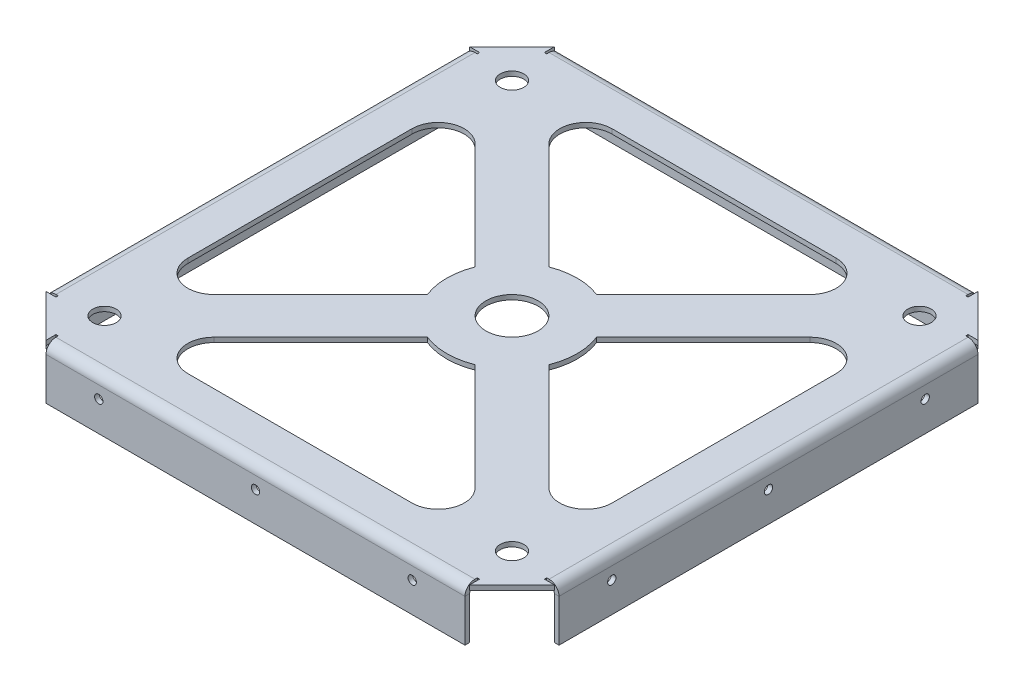
from build123d import *

# Parameters (mm, degrees)
BASE_FLANGE1_START              = -0.9
BASE_FLANGE1_DEPTH              = 0.9
EDGE_FLANGE1_STRIP_W            = 5.6
EDGE_FLANGE1_STRIP_H            = 0.9
EDGE_FLANGE1_STRIP_CUT_DEPTH    = 80.2
EDGE_FLANGE1_RELIEF_W           = 6.05
EDGE_FLANGE1_RELIEF_H           = 0.45
EDGE_FLANGE1_RELIEF_CUT_DEPTH   = 0.9
EDGE_FLANGE1_STRIP_2_W          = 5.6
EDGE_FLANGE1_STRIP_2_H          = 0.9
EDGE_FLANGE1_STRIP_CUT_2_DEPTH  = 80.2
EDGE_FLANGE1_RELIEF_2_W         = 6.05
EDGE_FLANGE1_RELIEF_2_H         = 0.45
EDGE_FLANGE1_RELIEF_CUT_2_DEPTH = 0.9
EDGE_FLANGE1_STRIP_3_W          = 5.6
EDGE_FLANGE1_STRIP_3_H          = 0.9
EDGE_FLANGE1_STRIP_CUT_3_DEPTH  = 80.2
EDGE_FLANGE1_RELIEF_3_W         = 6.05
EDGE_FLANGE1_RELIEF_3_H         = 0.45
EDGE_FLANGE1_RELIEF_CUT_3_DEPTH = 0.9
EDGE_FLANGE1_STRIP_4_W          = 5.6
EDGE_FLANGE1_STRIP_4_H          = 0.9
EDGE_FLANGE1_STRIP_CUT_4_DEPTH  = 80.2
EDGE_FLANGE1_RELIEF_4_W         = 6.05
EDGE_FLANGE1_RELIEF_4_H         = 0.45
EDGE_FLANGE1_RELIEF_CUT_4_DEPTH = 0.9
EDGE_FLANGE1_DEPTH              = 80.2
EDGE_FLANGE1_BEND_DEPTH         = 80.2
EDGE_FLANGE1_BEND_2_DEPTH       = 80.2
EDGE_FLANGE1_BEND_3_DEPTH       = 80.2
SKETCH18_R                      = 5
CUT_EXTRUDE1_DEPTH              = 10
M2X0_4_TAPPED_HOLE1_D           = 1.6
M2X0_4_TAPPED_HOLE1_DEPTH       = 5.2
M2X0_4_TAPPED_HOLE1_TIP         = 0.480688495
M2X0_4_TAPPED_HOLE2_D           = 1.6
M2X0_4_TAPPED_HOLE2_DEPTH       = 5.2
M2X0_4_TAPPED_HOLE2_TIP         = 0.480688495
M2X0_4_TAPPED_HOLE3_D           = 1.6
M2X0_4_TAPPED_HOLE3_DEPTH       = 5.2
M2X0_4_TAPPED_HOLE3_TIP         = 0.480688495
M2X0_4_TAPPED_HOLE4_D           = 1.6
M2X0_4_TAPPED_HOLE4_DEPTH       = 5.2
M2X0_4_TAPPED_HOLE4_TIP         = 0.480688495
M4_CLEARANCE_HOLE1_D            = 4.5


# Read off the part's stored shape, not the designer's step: Base-Flange1
# Sheet-metal steps are written as plain solids
with BuildPart() as part:
    # Base-Flange1 outline → Base-Flange1 (new body)
    with BuildSketch(Plane(origin=(0, 0, 0), x_dir=(1, 0, 0), z_dir=(0, 1, 0)).offset(BASE_FLANGE1_START)):
        Polygon((98.2, 89.2), (89.2, 98.2), (9, 98.2), (0, 89.2), (0, 9), (9, 0), (89.2, 0), (98.2, 9), align=None)
    extrude(amount=BASE_FLANGE1_DEPTH)

    # Edge-Flange1 strip (across the edge) → Edge-Flange1 strip cut (cut)
    with BuildSketch(Plane(origin=(98.2, -0.9, -89.2), x_dir=(-1, 0, 0), z_dir=(0, 0, 1))):
        with Locations((-0.9, -0.45)):
            Rectangle(EDGE_FLANGE1_STRIP_W, EDGE_FLANGE1_STRIP_H)
    extrude(amount=EDGE_FLANGE1_STRIP_CUT_DEPTH, mode=Mode.SUBTRACT)

    # Edge-Flange1 relief (on the sheet) → Edge-Flange1 relief cut (cut)
    with BuildSketch(Plane(origin=(96.3, -0.9, -89.2), x_dir=(-1, 0, 0), z_dir=(0, -1, 0))):
        with Locations((-2.575, 0.225)):
            Rectangle(EDGE_FLANGE1_RELIEF_W, EDGE_FLANGE1_RELIEF_H)
        with Locations((-2.575, -80.425)):
            Rectangle(EDGE_FLANGE1_RELIEF_W, EDGE_FLANGE1_RELIEF_H)
    extrude(amount=-EDGE_FLANGE1_RELIEF_CUT_DEPTH, mode=Mode.SUBTRACT)

    # Edge-Flange1 strip 2 (across the edge) → Edge-Flange1 strip cut 2 (cut)
    with BuildSketch(Plane(origin=(89.2, -0.9, 0), x_dir=(0, 0, -1), z_dir=(-1, 0, 0))):
        with Locations((-0.9, -0.45)):
            Rectangle(EDGE_FLANGE1_STRIP_2_W, EDGE_FLANGE1_STRIP_2_H)
    extrude(amount=EDGE_FLANGE1_STRIP_CUT_2_DEPTH, mode=Mode.SUBTRACT)

    # Edge-Flange1 relief 2 (on the sheet) → Edge-Flange1 relief cut 2 (cut)
    with BuildSketch(Plane(origin=(89.2, -0.9, -1.9), x_dir=(0, 0, -1), z_dir=(0, -1, 0))):
        with Locations((-2.575, 0.225)):
            Rectangle(EDGE_FLANGE1_RELIEF_2_W, EDGE_FLANGE1_RELIEF_2_H)
        with Locations((-2.575, -80.425)):
            Rectangle(EDGE_FLANGE1_RELIEF_2_W, EDGE_FLANGE1_RELIEF_2_H)
    extrude(amount=-EDGE_FLANGE1_RELIEF_CUT_2_DEPTH, mode=Mode.SUBTRACT)

    # Edge-Flange1 strip 3 (across the edge) → Edge-Flange1 strip cut 3 (cut)
    with BuildSketch(Plane(origin=(0, -0.9, -9), x_dir=(1, 0, 0), z_dir=(0, 0, -1))):
        with Locations((-0.9, -0.45)):
            Rectangle(EDGE_FLANGE1_STRIP_3_W, EDGE_FLANGE1_STRIP_3_H)
    extrude(amount=EDGE_FLANGE1_STRIP_CUT_3_DEPTH, mode=Mode.SUBTRACT)

    # Edge-Flange1 relief 3 (on the sheet) → Edge-Flange1 relief cut 3 (cut)
    with BuildSketch(Plane(origin=(1.9, -0.9, -9), x_dir=(1, 0, 0), z_dir=(0, -1, 0))):
        with Locations((-2.575, 0.225)):
            Rectangle(EDGE_FLANGE1_RELIEF_3_W, EDGE_FLANGE1_RELIEF_3_H)
        with Locations((-2.575, -80.425)):
            Rectangle(EDGE_FLANGE1_RELIEF_3_W, EDGE_FLANGE1_RELIEF_3_H)
    extrude(amount=-EDGE_FLANGE1_RELIEF_CUT_3_DEPTH, mode=Mode.SUBTRACT)

    # Edge-Flange1 strip 4 (across the edge) → Edge-Flange1 strip cut 4 (cut)
    with BuildSketch(Plane(origin=(9, -0.9, -98.2), x_dir=(0, 0, 1), z_dir=(1, 0, 0))):
        with Locations((-0.9, -0.45)):
            Rectangle(EDGE_FLANGE1_STRIP_4_W, EDGE_FLANGE1_STRIP_4_H)
    extrude(amount=EDGE_FLANGE1_STRIP_CUT_4_DEPTH, mode=Mode.SUBTRACT)

    # Edge-Flange1 relief 4 (on the sheet) → Edge-Flange1 relief cut 4 (cut)
    with BuildSketch(Plane(origin=(9, -0.9, -96.3), x_dir=(0, 0, 1), z_dir=(0, -1, 0))):
        with Locations((-2.575, 0.225)):
            Rectangle(EDGE_FLANGE1_RELIEF_4_W, EDGE_FLANGE1_RELIEF_4_H)
        with Locations((-2.575, -80.425)):
            Rectangle(EDGE_FLANGE1_RELIEF_4_W, EDGE_FLANGE1_RELIEF_4_H)
    extrude(amount=-EDGE_FLANGE1_RELIEF_CUT_4_DEPTH, mode=Mode.SUBTRACT)

    # Edge-Flange1 section (across the edge) → Edge-Flange1 (add)
    with BuildSketch(Plane(origin=(98.2, -0.9, -89.2), x_dir=(-1, 0, 0), z_dir=(0, 0, 1))):
        with BuildLine():
            Line((0, 1), (0, 9.1))
            Line((0, 9.1), (0.9, 9.1))
            Line((0.9, 9.1), (0.9, 1))
            ThreePointArc((0.9, 1), (1.192893219, 0.292893219), (1.9, 0))
            Line((1.9, 0), (1.9, -0.9))
            ThreePointArc((1.9, -0.9), (0.556497116, -0.343502884), (0, 1))
        make_face()
    extrude(amount=EDGE_FLANGE1_DEPTH)

    # Edge-Flange1 section 2 (across the edge) → Edge-Flange1 bend (add)
    with BuildSketch(Plane(origin=(89.2, -0.9, 0), x_dir=(0, 0, -1), z_dir=(-1, 0, 0))):
        with BuildLine():
            Line((0, 1), (0, 9.1))
            Line((0, 9.1), (0.9, 9.1))
            Line((0.9, 9.1), (0.9, 1))
            ThreePointArc((0.9, 1), (1.192893219, 0.292893219), (1.9, 0))
            Line((1.9, 0), (1.9, -0.9))
            ThreePointArc((1.9, -0.9), (0.556497116, -0.343502884), (0, 1))
        make_face()
    extrude(amount=EDGE_FLANGE1_BEND_DEPTH)

    # Edge-Flange1 section 3 (across the edge) → Edge-Flange1 bend 2 (add)
    with BuildSketch(Plane(origin=(0, -0.9, -9), x_dir=(1, 0, 0), z_dir=(0, 0, -1))):
        with BuildLine():
            Line((0, 1), (0, 9.1))
            Line((0, 9.1), (0.9, 9.1))
            Line((0.9, 9.1), (0.9, 1))
            ThreePointArc((0.9, 1), (1.192893219, 0.292893219), (1.9, 0))
            Line((1.9, 0), (1.9, -0.9))
            ThreePointArc((1.9, -0.9), (0.556497116, -0.343502884), (0, 1))
        make_face()
    extrude(amount=EDGE_FLANGE1_BEND_2_DEPTH)

    # Edge-Flange1 section 4 (across the edge) → Edge-Flange1 bend 3 (add)
    with BuildSketch(Plane(origin=(9, -0.9, -98.2), x_dir=(0, 0, 1), z_dir=(1, 0, 0))):
        with BuildLine():
            Line((0, 1), (0, 9.1))
            Line((0, 9.1), (0.9, 9.1))
            Line((0.9, 9.1), (0.9, 1))
            ThreePointArc((0.9, 1), (1.192893219, 0.292893219), (1.9, 0))
            Line((1.9, 0), (1.9, -0.9))
            ThreePointArc((1.9, -0.9), (0.556497116, -0.343502884), (0, 1))
        make_face()
    extrude(amount=EDGE_FLANGE1_BEND_3_DEPTH)

    # Sketch18 → Cut-Extrude1 (cut)
    with BuildSketch(Plane(origin=(0, 0, 0), x_dir=(1, 0, 0), z_dir=(0, 1, 0))):
        with Locations(Location((49.1, 49.1, 0), (0, 0, 270))):
            Circle(SKETCH18_R)
        with BuildLine():
            Line((70.557864376, 8.5), (27.642135624, 8.5))
            ThreePointArc((27.642135624, 8.5), (23.022737961, 11.586582838), (24.106601718, 17.035533906))
            Line((24.106601718, 17.035533906), (44.534608033, 37.463540221))
            ThreePointArc((44.534608033, 37.463540221), (49.1, 36.6), (53.665391967, 37.463540221))
            Line((53.665391967, 37.463540221), (74.093398282, 17.035533906))
            ThreePointArc((74.093398282, 17.035533906), (75.177262039, 11.586582838), (70.557864376, 8.5))
        make_face()
        with BuildLine():
            Line((8.5, 27.642135624), (8.5, 70.557864376))
            ThreePointArc((8.5, 70.557864376), (11.586582838, 75.177262039), (17.035533906, 74.093398282))
            Line((17.035533906, 74.093398282), (37.463540221, 53.665391967))
            ThreePointArc((37.463540221, 53.665391967), (36.6, 49.1), (37.463540221, 44.534608033))
            Line((37.463540221, 44.534608033), (17.035533906, 24.106601718))
            ThreePointArc((17.035533906, 24.106601718), (11.586582838, 23.022737961), (8.5, 27.642135624))
        make_face()
        with BuildLine():
            Line((27.642135624, 89.7), (70.557864376, 89.7))
            ThreePointArc((70.557864376, 89.7), (75.177262039, 86.613417162), (74.093398282, 81.164466094))
            Line((74.093398282, 81.164466094), (53.665391967, 60.736459779))
            ThreePointArc((53.665391967, 60.736459779), (49.1, 61.6), (44.534608033, 60.736459779))
            Line((44.534608033, 60.736459779), (24.106601718, 81.164466094))
            ThreePointArc((24.106601718, 81.164466094), (23.022737961, 86.613417162), (27.642135624, 89.7))
        make_face()
        with BuildLine():
            Line((89.7, 70.557864376), (89.7, 27.642135624))
            ThreePointArc((89.7, 27.642135624), (86.613417162, 23.022737961), (81.164466094, 24.106601718))
            Line((81.164466094, 24.106601718), (60.736459779, 44.534608033))
            ThreePointArc((60.736459779, 44.534608033), (61.6, 49.1), (60.736459779, 53.665391967))
            Line((60.736459779, 53.665391967), (81.164466094, 74.093398282))
            ThreePointArc((81.164466094, 74.093398282), (86.613417162, 75.177262039), (89.7, 70.557864376))
        make_face()
    extrude(amount=-CUT_EXTRUDE1_DEPTH, mode=Mode.SUBTRACT)

    # M2x0.4 Tapped Hole1
    with Locations(Plane(origin=(98.2, -86.276184469, 4.184287404), x_dir=(0, 0, 1), z_dir=(1, 0, 0))):
        with Locations((-83.284287404, -82.026184469), (-53.284287404, -82.026184469), (-23.284287404, -82.026184469)):
            Hole(M2X0_4_TAPPED_HOLE1_D / 2, depth=M2X0_4_TAPPED_HOLE1_DEPTH)
            with Locations((0, 0, -(M2X0_4_TAPPED_HOLE1_DEPTH + M2X0_4_TAPPED_HOLE1_TIP / 2))):  # 118° drill point
                Cone(0, M2X0_4_TAPPED_HOLE1_D / 2, M2X0_4_TAPPED_HOLE1_TIP, mode=Mode.SUBTRACT)

    # M2x0.4 Tapped Hole2
    with Locations(Plane(origin=(24.191898312, -86.276184469, -98.2), x_dir=(1, 0, 0), z_dir=(0, 0, -1))):
        with Locations((-5.091898312, -82.026184469), (24.908101688, -82.026184469), (54.908101688, -82.026184469)):
            Hole(M2X0_4_TAPPED_HOLE2_D / 2, depth=M2X0_4_TAPPED_HOLE2_DEPTH)
            with Locations((0, 0, -(M2X0_4_TAPPED_HOLE2_DEPTH + M2X0_4_TAPPED_HOLE2_TIP / 2))):  # 118° drill point
                Cone(0, M2X0_4_TAPPED_HOLE2_D / 2, M2X0_4_TAPPED_HOLE2_TIP, mode=Mode.SUBTRACT)

    # M2x0.4 Tapped Hole3
    with Locations(Plane(origin=(0, -86.276184469, 4.184287404), x_dir=(0, 0, -1), z_dir=(-1, 0, 0))):
        with Locations((83.284287404, -82.026184469), (53.284287404, -82.026184469), (23.284287404, -82.026184469)):
            Hole(M2X0_4_TAPPED_HOLE3_D / 2, depth=M2X0_4_TAPPED_HOLE3_DEPTH)
            with Locations((0, 0, -(M2X0_4_TAPPED_HOLE3_DEPTH + M2X0_4_TAPPED_HOLE3_TIP / 2))):  # 118° drill point
                Cone(0, M2X0_4_TAPPED_HOLE3_D / 2, M2X0_4_TAPPED_HOLE3_TIP, mode=Mode.SUBTRACT)

    # M2x0.4 Tapped Hole4
    with Locations(Plane(origin=(24.191898312, -86.276184469, 0), x_dir=(-1, 0, 0), z_dir=(0, 0, 1))):
        with Locations((-24.908101688, -82.026184469), (5.091898312, -82.026184469), (-54.908101688, -82.026184469)):
            Hole(M2X0_4_TAPPED_HOLE4_D / 2, depth=M2X0_4_TAPPED_HOLE4_DEPTH)
            with Locations((0, 0, -(M2X0_4_TAPPED_HOLE4_DEPTH + M2X0_4_TAPPED_HOLE4_TIP / 2))):  # 118° drill point
                Cone(0, M2X0_4_TAPPED_HOLE4_D / 2, M2X0_4_TAPPED_HOLE4_TIP, mode=Mode.SUBTRACT)

    # M4 Clearance Hole1 (through all)
    with Locations(Plane(origin=(24.191898312, -0.9, 4.184287404), x_dir=(0, 0, 1), z_dir=(0, -1, 0))):
        with Locations((-92.284287404, 14.091898312), (-92.284287404, -63.908101688), (-14.284287404, -63.908101688), (-14.284287404, 14.091898312)):
            Hole(M4_CLEARANCE_HOLE1_D / 2)


solid = part.part
